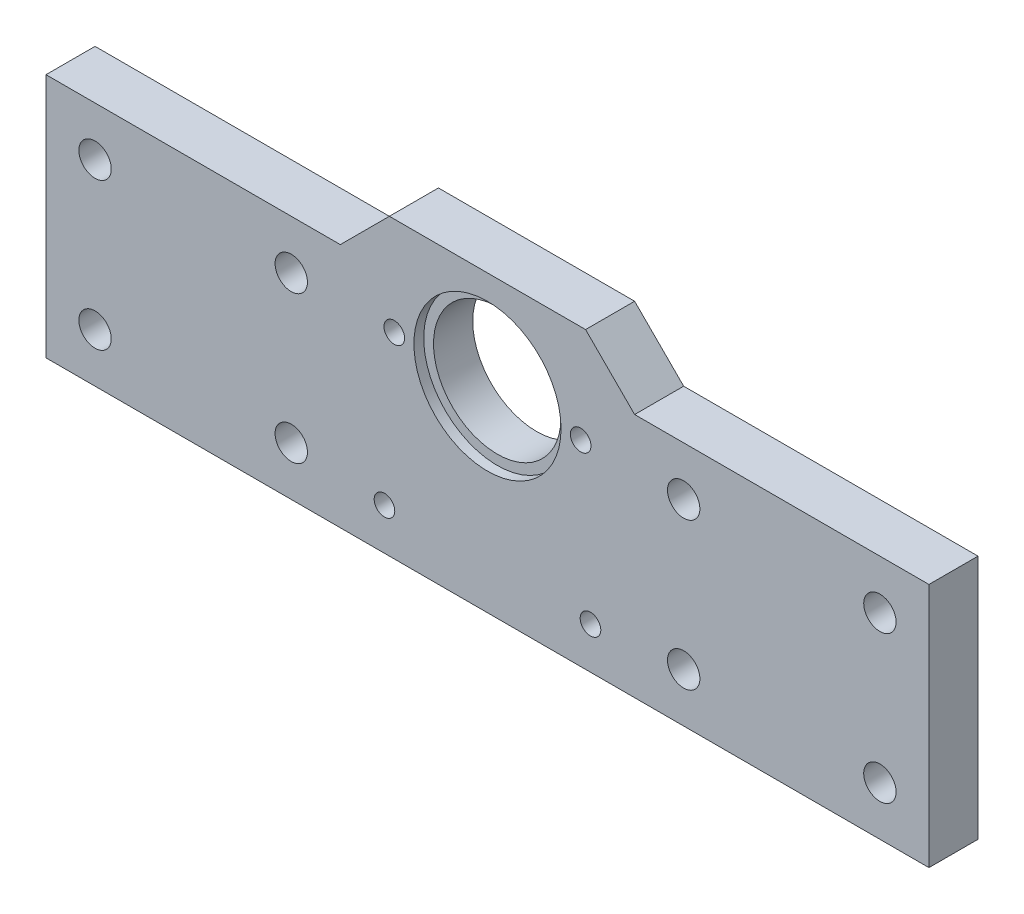
from build123d import *

# Parameters (mm, degrees)
ESQUISSE1_W             = 90
ESQUISSE1_H             = 25
BOSS_EXTRU_1_DEPTH      = 5
ESQUISSE6_W             = 20
ESQUISSE6_H             = 5
BOSS_EXTRU_2_DEPTH      = 5
ESQUISSE3_R             = 6.5
ENL_V_MAT_EXTRU_2_DEPTH = 96
ESQUISSE4_R             = 1.05
ENL_V_MAT_EXTRU_3_DEPTH = 96
ESQUISSE5_R             = 1.65
ENL_V_MAT_EXTRU_4_DEPTH = 5
CHANFREIN1_SIZE         = 5
ESQUISSE7_R             = 7.5
ENL_V_MAT_EXTRU_5_DEPTH = 1


with BuildPart() as part:
    # Esquisse1 → Boss.-Extru.1 (new body)
    with BuildSketch(Plane.XY):
        with Locations((45, 12.5)):
            Rectangle(ESQUISSE1_W, ESQUISSE1_H)
    extrude(amount=BOSS_EXTRU_1_DEPTH)

    # Esquisse6 → Boss.-Extru.2 (add)
    with BuildSketch(Plane.XY.offset(5)):
        with Locations((45, 27.5)):
            Rectangle(ESQUISSE6_W, ESQUISSE6_H)
    extrude(amount=-BOSS_EXTRU_2_DEPTH)

    # Esquisse3 → Enlèv. mat.-Extru.2 (cut, through all)
    with BuildSketch(Plane.XY.offset(5)):
        with Locations((45, 20)):
            Circle(ESQUISSE3_R)
    extrude(amount=-ENL_V_MAT_EXTRU_2_DEPTH, mode=Mode.SUBTRACT)

    # Esquisse4 → Enlèv. mat.-Extru.3 (cut, through all)
    with BuildSketch(Plane.XY.offset(5)):
        with Locations((34.5, 4.25)):
            Circle(ESQUISSE4_R)
        with Locations(Location((54.5, 20, 0), (0, 0, 180))):
            Circle(ESQUISSE4_R)
        with Locations(Location((55.5, 4.25, 0), (0, 0, 180))):
            Circle(ESQUISSE4_R)
        with Locations((35.5, 20)):
            Circle(ESQUISSE4_R)
    extrude(amount=-ENL_V_MAT_EXTRU_3_DEPTH, mode=Mode.SUBTRACT)

    # Esquisse5 → Enlèv. mat.-Extru.4 (cut)
    with BuildSketch(Plane.XY.offset(5)):
        with Locations((5, 20)):
            Circle(ESQUISSE5_R)
        with Locations((25, 20)):
            Circle(ESQUISSE5_R)
        with Locations(Location((25, 5, 0), (0, 0, 180))):
            Circle(ESQUISSE5_R)
        with Locations(Location((5, 5, 0), (0, 0, 180))):
            Circle(ESQUISSE5_R)
        with Locations((85, 5)):
            Circle(ESQUISSE5_R)
        with Locations((65, 5)):
            Circle(ESQUISSE5_R)
        with Locations(Location((65, 20, 0), (0, 0, 180))):
            Circle(ESQUISSE5_R)
        with Locations(Location((85, 20, 0), (0, 0, 180))):
            Circle(ESQUISSE5_R)
    extrude(amount=-ENL_V_MAT_EXTRU_4_DEPTH, mode=Mode.SUBTRACT)

    # Chanfrein1
    chanfrein1_edges = [part.edges().sort_by_distance(p)[0] for p in [
        (55, 25, 2.5),
        (35, 25, 2.5),
    ]]
    chamfer(chanfrein1_edges, length=CHANFREIN1_SIZE - 0.0001)  # a hair under: the kernel refuses the full size

    # Esquisse7 → Enlèv. mat.-Extru.5 (cut)
    with BuildSketch(Plane.XY.offset(5)):
        with Locations((45, 20)):
            Circle(ESQUISSE7_R)
    extrude(amount=-ENL_V_MAT_EXTRU_5_DEPTH, mode=Mode.SUBTRACT)


solid = part.part
